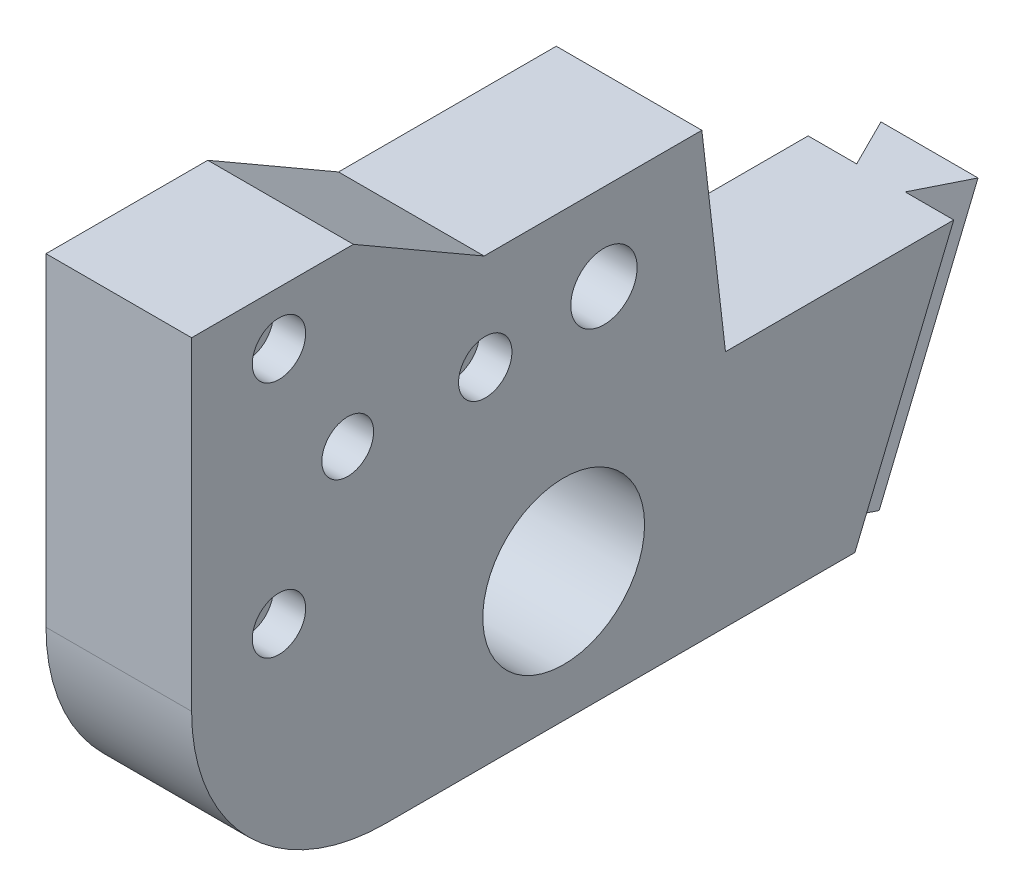
from build123d import *

# Parameters (mm, degrees)
SKETCH1_W                                        = 32
SKETCH1_H                                        = 52
BOSS_EXTRUDE1_DEPTH                              = 9
CUT_EXTRUDE2_DEPTH                               = 58.078892771
F_10_0_10_DIAMETER_HOLE1_D                       = 10
FILLET3_R                                        = 12
CUT_EXTRUDE3_DEPTH                               = 58.078892771
M4X0_7_TAPPED_HOLE2_D                            = 2.1
M4X0_7_TAPPED_HOLE2_CBORE_D                      = 3.3
M4X0_7_TAPPED_HOLE2_CBORE_DEPTH                  = 2
CBORE_FOR_M3_HEX_HEAD_MACHINE_SCREW5_D           = 3.2
CBORE_FOR_M3_HEX_HEAD_MACHINE_SCREW5_CBORE_D     = 10.2
CBORE_FOR_M3_HEX_HEAD_MACHINE_SCREW5_CBORE_DEPTH = 1
F_4_1_4_1_DIAMETER_HOLE3_D                       = 4.1
CUT_EXTRUDE4_DEPTH                               = 58.078892771
FILLET3_OF_MIRROR11_R                            = 12
CUT_EXTRUDE5_START                               = -9
CUT_EXTRUDE5_OUTLINE_R                           = 5
CUT_EXTRUDE5_OUTLINE_R_2                         = 2.05
CUT_EXTRUDE5_OUTLINE_R_3                         = 1.05
CUT_EXTRUDE5_OUTLINE_R_4                         = 1.6
CUT_EXTRUDE5_DEPTH                               = 9
F_4_1_4_1_DIAMETER_HOLE8_D                       = 4.1
M4X0_7_TAPPED_HOLE3_D                            = 2.1
M4X0_7_TAPPED_HOLE3_CBORE_D                      = 3.3
M4X0_7_TAPPED_HOLE3_CBORE_DEPTH                  = 2


# Read off the part's stored shape, not the designer's step: Cut-Extrude5
with BuildPart() as part:
    # Sketch1 → Boss-Extrude1 (new body)
    with BuildSketch(Plane(origin=(-2, 0, 0), x_dir=(0, -1, 0), z_dir=(-1, 0, 0))):
        with Locations((-8, 25)):
            Rectangle(SKETCH1_W, SKETCH1_H)
    boss_extrude1 = extrude(amount=-BOSS_EXTRUDE1_DEPTH)

    # Sketch3 → Cut-Extrude2 (cut, through all)
    with BuildSketch(Plane(origin=(7, 0, 0), x_dir=(0, 0, -1), z_dir=(1, 0, 0))):
        Polygon((4, 6.75), (-18, 6.75), (-20, 24), (4, 24), align=None)
    cut_extrude2 = extrude(amount=-CUT_EXTRUDE2_DEPTH, mode=Mode.SUBTRACT)

    # Ø10.0 (10) Diameter Hole1 (through all)
    with Locations(Plane.ZY.offset(2)):
        with Locations((28, 0)):
            f_10_0_10_diameter_hole1 = Hole(F_10_0_10_DIAMETER_HOLE1_D / 2)

    # Fillet3
    fillet3_edges = [part.edges().sort_by_distance(p)[0] for p in [
        (2.5, -8, 51),
    ]]
    fillet(fillet3_edges, radius=FILLET3_R)

    # Cut-Sweep1: sweep along a path in Sketch22
    with BuildLine(Plane(origin=(-2, 0, 0), x_dir=(0, -1, 0), z_dir=(-1, 0, 0))) as cut_sweep1_path:
        Line((8, 11), (-6.75, 4.890349955))
    # Sketch21 → Cut-Sweep1 (sweep, cut)
    with BuildSketch(Plane.XZ.offset(8)):
        Polygon((7, 7), (5.5, 7), (4, 10), (7, 10), align=None)
        Polygon((1, 10), (-0.5, 7), (-2, 7), (-2, 10), align=None)
    cut_sweep1 = sweep(path=cut_sweep1_path.line, mode=Mode.SUBTRACT)

    # Sketch23 → Cut-Extrude3 (cut, symmetric)
    with BuildSketch(Plane.ZY.offset(2)):
        Polygon((-1, 6.75), (-1, -8), (7, -8), (0.890349955, 6.75), align=None)
    cut_extrude3 = extrude(amount=CUT_EXTRUDE3_DEPTH, both=True, mode=Mode.SUBTRACT)

    # M4x0.7 Tapped Hole2 (through all)
    with Locations(Plane(origin=(-2, 13.349760492, 32.849760492), x_dir=(0, 0, -1), z_dir=(-1, 0, 0))):
        with Locations((0, 0), (-12.75, -7.361215932), (-12.75, 7.361215932)):
            CounterBoreHole(M4X0_7_TAPPED_HOLE2_D / 2, M4X0_7_TAPPED_HOLE2_CBORE_D / 2, M4X0_7_TAPPED_HOLE2_CBORE_DEPTH)

    # CBORE for M3 Hex Head Machine Screw5 (through all)
    with Locations(Plane(origin=(7, 13.349760492, 41.349760492), x_dir=(0, 0, 1), z_dir=(1, 0, 0))):
        with Locations((0, 0)):
            cbore_for_m3_hex_head_machine_screw5 = CounterBoreHole(CBORE_FOR_M3_HEX_HEAD_MACHINE_SCREW5_D / 2, CBORE_FOR_M3_HEX_HEAD_MACHINE_SCREW5_CBORE_D / 2, CBORE_FOR_M3_HEX_HEAD_MACHINE_SCREW5_CBORE_DEPTH)

    # Ø4.1 (4.1) Diameter Hole3 (through all)
    with Locations(Plane(origin=(-2, 14, 25.510762466), x_dir=(0, 0, -1), z_dir=(-1, 0, 0))):
        with Locations((0, 0)):
            Hole(F_4_1_4_1_DIAMETER_HOLE3_D / 2)

    # Sketch37 → Cut-Extrude4 (cut, symmetric)
    with BuildSketch(Plane.ZY.offset(2)):
        Polygon((32.919624828, 19.334793219), (41, 24), (20, 24), (19.867875139, 22.860423075), (19.45910646, 19.334793219), align=None)
    cut_extrude4 = extrude(amount=CUT_EXTRUDE4_DEPTH, both=True, mode=Mode.SUBTRACT)

    # Mirror11: Boss-Extrude1, Cut-Extrude2, Ø10.0 (10) Diameter Hole1, Cut-Sweep1, Cut-Extrude3, CBORE for M3 Hex Head Machine Screw5, Cut-Extrude4 across plane
    add(boss_extrude1.mirror(Plane.ZY.offset(2)))
    add(cut_extrude2.mirror(Plane.ZY.offset(2)), mode=Mode.SUBTRACT)
    add(f_10_0_10_diameter_hole1.mirror(Plane.ZY.offset(2)), mode=Mode.SUBTRACT)
    add(cut_sweep1.mirror(Plane.ZY.offset(2)), mode=Mode.SUBTRACT)
    add(cut_extrude3.mirror(Plane.ZY.offset(2)), mode=Mode.SUBTRACT)
    add(cbore_for_m3_hex_head_machine_screw5.mirror(Plane.ZY.offset(2)), mode=Mode.SUBTRACT)
    add(cut_extrude4.mirror(Plane.ZY.offset(2)), mode=Mode.SUBTRACT)

    # Fillet3 of Mirror11
    fillet3_of_mirror11_edges = [part.edges().sort_by_distance(p)[0] for p in [
        (-6.5, -8, 51),
    ]]
    fillet(fillet3_of_mirror11_edges, radius=FILLET3_OF_MIRROR11_R)

    # Cut-Extrude5 outline → Cut-Extrude5 (cut)
    with BuildSketch(Plane(origin=(7, 0, 0), x_dir=(0, 0, -1), z_dir=(1, 0, 0)).offset(CUT_EXTRUDE5_START)):
        with BuildLine():
            Line((-32.919624828, 19.334793219), (-41, 24))
            Line((-41, 24), (-51, 24))
            Line((-51, 24), (-51, 4))
            ThreePointArc((-51, 4), (-47.485281374, -4.485281374), (-39, -8))
            Line((-39, -8), (-7, -8))
            Line((-7, -8), (-0.890349955, 6.75))
            Line((-0.890349955, 6.75), (-18, 6.75))
            Line((-18, 6.75), (-19.45910646, 19.334793219))
            Line((-19.45910646, 19.334793219), (-32.919624828, 19.334793219))
        make_face()
        with Locations((-28, 0)):
            Circle(CUT_EXTRUDE5_OUTLINE_R, mode=Mode.SUBTRACT)
        with Locations((-25.510762466, 14)):
            Circle(CUT_EXTRUDE5_OUTLINE_R_2, mode=Mode.SUBTRACT)
        with Locations((-45.599760492, 5.98854456)):
            Circle(CUT_EXTRUDE5_OUTLINE_R_3, mode=Mode.SUBTRACT)
        with Locations((-41.349760492, 13.349760492)):
            Circle(CUT_EXTRUDE5_OUTLINE_R_4, mode=Mode.SUBTRACT)
        with Locations((-32.849760492, 13.349760492)):
            Circle(CUT_EXTRUDE5_OUTLINE_R_3, mode=Mode.SUBTRACT)
        with Locations((-45.599760492, 20.710976424)):
            Circle(CUT_EXTRUDE5_OUTLINE_R_3, mode=Mode.SUBTRACT)
    extrude(amount=CUT_EXTRUDE5_DEPTH, mode=Mode.SUBTRACT)

    # Ø4.1 (4.1) Diameter Hole8 (through all)
    with Locations(Plane(origin=(-2, 14, 25.510762466), x_dir=(0, 0, 1), z_dir=(1, 0, 0))):
        with Locations((0, 0)):
            Hole(F_4_1_4_1_DIAMETER_HOLE8_D / 2)

    # M4x0.7 Tapped Hole3 (through all)
    with Locations(Plane(origin=(-2, 13.349760492, 32.849760492), x_dir=(0, 0, 1), z_dir=(1, 0, 0))):
        with Locations((0, 0), (12.75, -7.361215932), (12.75, 7.361215932)):
            CounterBoreHole(M4X0_7_TAPPED_HOLE3_D / 2, M4X0_7_TAPPED_HOLE3_CBORE_D / 2, M4X0_7_TAPPED_HOLE3_CBORE_DEPTH)


solid = part.part
